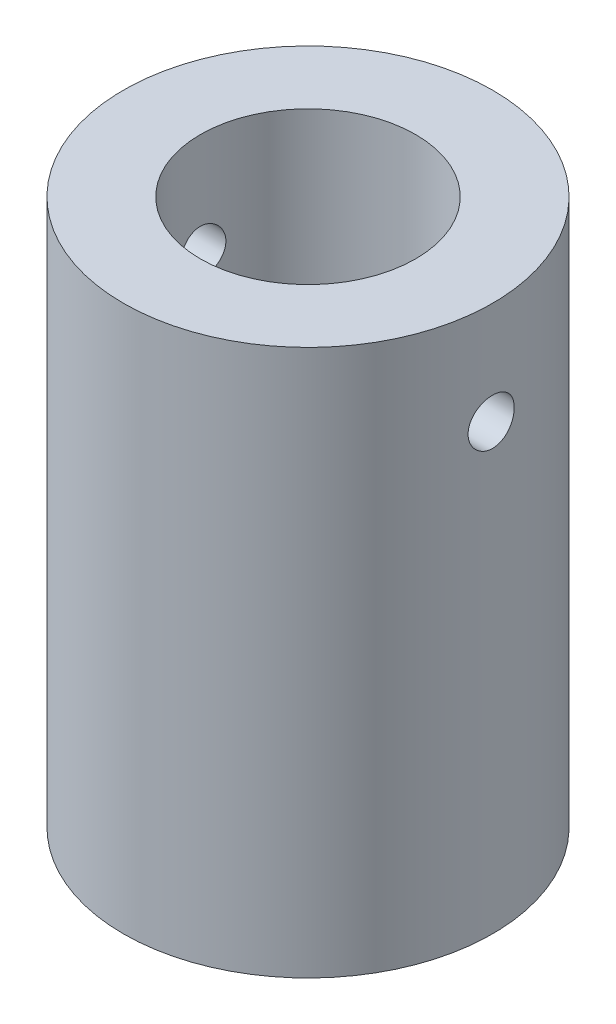
from build123d import *

# Parameters (mm, degrees)
SKETCH_1_R          = 12
SKETCH_1_R_2        = 8
EXTRUDE_1_DEPTH     = 7.5
SKETCH_2_R          = 12
EXTRUDE_2_DEPTH     = 28
CUT_EXTRUDE_3_DEPTH = 11
SKETCH_4_R          = 7
CUT_EXTRUDE_4_DEPTH = 16
SKETCH_5_R          = 1.5
CUT_EXTRUDE_5_DEPTH = 30


with BuildPart() as part:
    # Эскиз1 → Вытянуть1 (new body)
    with BuildSketch(Plane(origin=(0, 0, 0), x_dir=(1, 0, 0), z_dir=(0, 1, 0))):
        Circle(SKETCH_1_R)
        Circle(SKETCH_1_R_2, mode=Mode.SUBTRACT)
    extrude(amount=EXTRUDE_1_DEPTH)

    # Эскиз2 → Вытянуть2 (add)
    with BuildSketch(Plane(origin=(0, 7.5, 0), x_dir=(1, 0, 0), z_dir=(0, 1, 0))):
        Circle(SKETCH_2_R)
    extrude(amount=EXTRUDE_2_DEPTH)

    # Эскиз3 → Вытянуть3 (cut)
    with BuildSketch(Plane.XZ.offset(-7.5)):
        Polygon((4.675379912, 1.625060824), (-1.625060824, 4.675379912), (-4.675379912, -1.625060824), (1.625060824, -4.675379912), align=None)
    extrude(amount=-CUT_EXTRUDE_3_DEPTH, mode=Mode.SUBTRACT)

    # Эскиз4 → Вытянуть4 (cut)
    with BuildSketch(Plane(origin=(0, 35.5, 0), x_dir=(1, 0, 0), z_dir=(0, 1, 0))):
        Circle(SKETCH_4_R)
    extrude(amount=-CUT_EXTRUDE_4_DEPTH, mode=Mode.SUBTRACT)

    # Эскиз5 → Вытянуть5 (cut, symmetric)
    with BuildSketch(Plane(origin=(0, 0, 0), x_dir=(0, 0, -1), z_dir=(1, 0, 0))):
        with Locations((0, 28.831403322)):
            Circle(SKETCH_5_R)
    extrude(amount=CUT_EXTRUDE_5_DEPTH, both=True, mode=Mode.SUBTRACT)


solid = part.part
